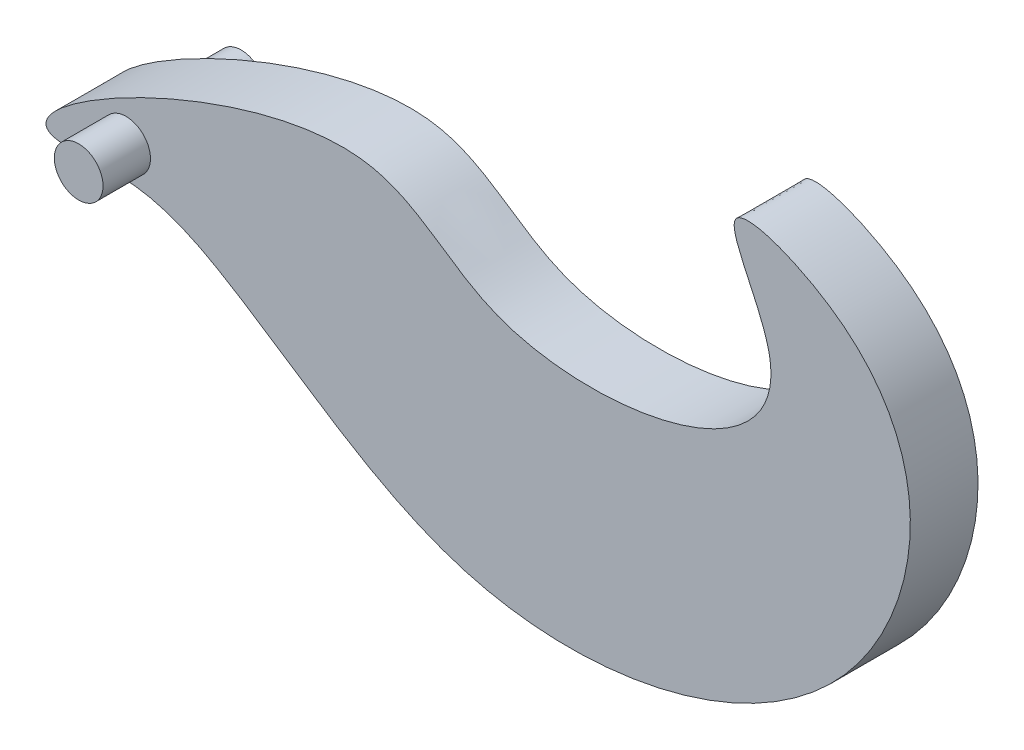
from build123d import *

# Parameters (mm, degrees)
BOSS_EXTRUDE1_DEPTH      = 10
SCALE3_DEPTH             = 10
SCALE3_2_DEPTH           = 2.917001447
SCALE3_START             = 7.083001447
SCALE3_3_DEPTH           = 2.916998553
SCALE3_START_2           = 2.917001447
SCALE3_4_DEPTH           = 4.166
BOSS_EXTRUDE2_DEPTH      = 5
BOSS_EXTRUDE2_DEPTH_BACK = 5
SKETCH2_R                = 1.5


# Read off the part's stored shape, not the designer's step: Scale3
with BuildPart() as part:
    # Sketch1 → Boss-Extrude1 (new body)
    with BuildSketch(Plane.XY):
        with BuildLine():
            add(Edge.make_bspline(
                [(0, 0), (-10.670461522, 1.374660592), (44.139535891, 31.970038054), (65.08756616, 1.633883454), (118.266036711, 11.374690568), (93.330454737, 45.088144462), (129.88911597, 31.412146084), (125.232761857, -19.955649385), (63.557877676, -35.204874795), (32.062717931, -8.850449266), (12.982907077, 1.103214072), (2.166842437, -0.279151272), (0, 0)],
                knots=[0, 0, 0, 0, 0.156063392, 0.226928128, 0.362315016, 0.412423951, 0.462532886, 0.590286105, 0.790721846, 0.917625991, 0.968308327, 1, 1, 1, 1], degree=3))
        make_face()
    extrude(amount=BOSS_EXTRUDE1_DEPTH)

    # Scale3 outline → Scale3 (cut)
    with BuildSketch(Plane.XY):
        with BuildLine():
            add(Edge.make_bspline(
                [(93.951110011, 10.326287986), (95.577429659, 6.401723068), (92.345367457, -8.531837193), (68.828896618, -14.346326664), (55.708013068, -3.367072989), (47.759363867, 0.779623158), (34.716507317, -0.887341074), (60.73921543, 13.638742029), (69.01426879, 1.655118995), (84.153756453, 3.758113028), (85.897144309, 8.295208629)],
                knots=[0.501097422, 0.501097422, 0.501097422, 0.501097422, 0.590286105, 0.790721846, 0.917625991, 0.968308327, 1, 1.156063392, 1.226928128, 1.343553737, 1.343553737, 1.343553737, 1.343553737], degree=3))
            add(Edge.make_bspline(
                [(85.897144309, 8.295208629), (78.667765269, 7.212043696), (60.334428885, 8.517199228), (44.139535891, 31.970038054), (-18.324957899, -2.898140301), (12.982907077, 1.103214072), (32.062717931, -8.850449266), (63.557877676, -35.204874795), (125.232761857, -19.955649385), (129.88911597, 31.412146084), (93.330454737, 45.088144462), (110.430491234, 21.968519958), (101.245634842, 13.058034148), (93.951110011, 10.326287986)],
                knots=[0, 0, 0, 0, 0.053177106, 0.124041841, 0.280105233, 0.311796907, 0.362479242, 0.489383387, 0.689819128, 0.817572347, 0.867681283, 0.917790218, 0.979142668, 0.979142668, 0.979142668, 0.979142668], degree=3))
        make_face()
    extrude(amount=SCALE3_DEPTH, mode=Mode.SUBTRACT)

    # Scale3 2 outline → Scale3 2 (cut)
    with BuildSketch(Plane.XY):
        with BuildLine():
            add(Edge.make_bspline(
                [(85.897144309, 8.295208629), (84.153756453, 3.758113028), (69.01426879, 1.655118995), (60.73921543, 13.638742029), (34.716507317, -0.887341074), (47.759363867, 0.779623158), (55.708013068, -3.367072989), (68.828896618, -14.346326664), (92.345367457, -8.531837193), (95.577429659, 6.401723068), (93.951110011, 10.326287986)],
                knots=[0, 0, 0, 0, 0.11662561, 0.187490346, 0.343553737, 0.375245411, 0.425927746, 0.552831891, 0.753267632, 0.842456315, 0.842456315, 0.842456315, 0.842456315], degree=3))
            add(Edge.make_bspline(
                [(85.897144309, 8.295208629), (88.732679648, 8.720051821), (91.47126886, 9.397605625), (93.951110011, 10.326287986)],
                knots=[0.280105233, 0.280105233, 0.280105233, 0.280105233, 0.300962566, 0.300962566, 0.300962566, 0.300962566], degree=3))
        make_face()
    extrude(amount=SCALE3_2_DEPTH, mode=Mode.SUBTRACT)

    # Scale3 3 outline → Scale3 3 (cut)
    with BuildSketch(Plane.XY.offset(SCALE3_START)):
        with BuildLine():
            add(Edge.make_bspline(
                [(85.897144309, 8.295208629), (84.153756453, 3.758113028), (69.01426879, 1.655118995), (60.73921543, 13.638742029), (34.716507317, -0.887341074), (47.759363867, 0.779623158), (55.708013068, -3.367072989), (68.828896618, -14.346326664), (92.345367457, -8.531837193), (95.577429659, 6.401723068), (93.951110011, 10.326287986)],
                knots=[0, 0, 0, 0, 0.11662561, 0.187490346, 0.343553737, 0.375245411, 0.425927746, 0.552831891, 0.753267632, 0.842456315, 0.842456315, 0.842456315, 0.842456315], degree=3))
            add(Edge.make_bspline(
                [(85.897144309, 8.295208629), (88.732679648, 8.720051821), (91.47126886, 9.397605625), (93.951110011, 10.326287986)],
                knots=[0.280105233, 0.280105233, 0.280105233, 0.280105233, 0.300962566, 0.300962566, 0.300962566, 0.300962566], degree=3))
        make_face()
    extrude(amount=SCALE3_3_DEPTH, mode=Mode.SUBTRACT)

    # Scale3 4 outline → Scale3 4 (add)
    with BuildSketch(Plane.XY.offset(SCALE3_START_2)):
        with BuildLine():
            add(Edge.make_bspline(
                [(85.897144309, 8.295208629), (86.177598872, 9.02508016), (86.478119459, 12.011082361), (81.232152222, 19.103745158), (90.503955054, 15.635315073), (93.24790126, 12.023241224), (93.951110011, 10.326287986)],
                knots=[0.343553737, 0.343553737, 0.343553737, 0.343553737, 0.362315016, 0.412423951, 0.462532886, 0.501097422, 0.501097422, 0.501097422, 0.501097422], degree=3))
            add(Edge.make_bspline(
                [(85.897144309, 8.295208629), (88.732679648, 8.720051821), (91.47126886, 9.397605625), (93.951110011, 10.326287986)],
                knots=[0.280105233, 0.280105233, 0.280105233, 0.280105233, 0.300962566, 0.300962566, 0.300962566, 0.300962566], degree=3))
        make_face()
    extrude(amount=SCALE3_4_DEPTH)

    # Sketch2 → Boss-Extrude2 (add, two sides: drawn at the far end of the back side and taken through both)
    with BuildSketch(Plane.XY.offset(5.000001447).offset(-BOSS_EXTRUDE2_DEPTH_BACK)):
        with Locations((46.5, 2.2)):
            Circle(SKETCH2_R)
    extrude(amount=BOSS_EXTRUDE2_DEPTH + BOSS_EXTRUDE2_DEPTH_BACK)


solid = part.part
